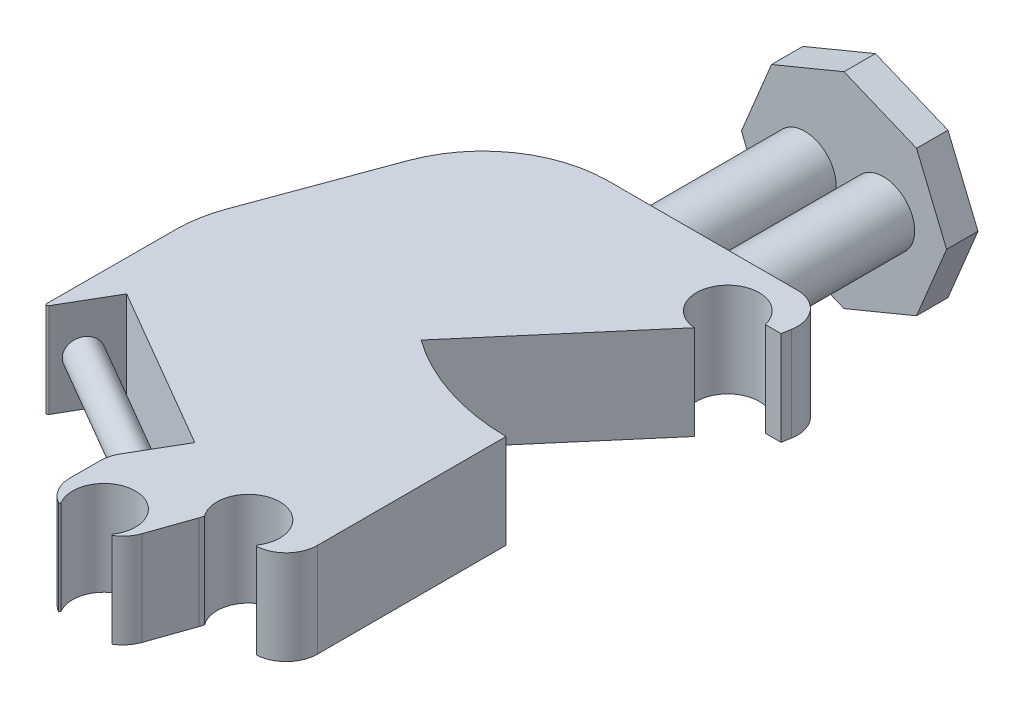
from build123d import *

# Parameters (mm, degrees)
SKETCH1_W                      = 5
SKETCH1_H                      = 25
BOSS_EXTRUDE1_DEPTH            = 10
BOSS_EXTRUDE2_DEPTH            = 2.5
BOSS_EXTRUDE3_START            = 2.5
BOSS_EXTRUDE3_DEPTH            = 2.5
BOSS_EXTRUDE4_DEPTH            = 5
DRAFT1_ANGLE                   = 60
DRAFT2_ANGLE                   = -10
SKETCH6_W                      = 5
SKETCH6_H                      = 15
SKETCH7_W                      = 5
SKETCH7_H                      = 15
SKETCH8_W                      = 5
SKETCH8_H                      = 25
F_10_0_10_DIAMETER_HOLE1_D     = 10
F_10_0_10_DIAMETER_HOLE1_DEPTH = 23.832037061
FILLET1_R                      = 5
FILLET2_R                      = 20


with BuildPart() as part:
    # Sketch1 → Revolve1 (revolve)
    with BuildSketch(Plane(origin=(0, -7.5, 0), x_dir=(1, 0, 0), z_dir=(0, 1, 0))):
        with Locations((-5.811233855, 90.876419512)):
            Rectangle(SKETCH1_W, SKETCH1_H)
    revolve(axis=Axis((-8.311233855, -7.5, -103.376419512), (0, 0, 1)))

    # Sketch2 → Boss-Extrude1 (add)
    with BuildSketch(Plane(origin=(0, -2.5, 0), x_dir=(1, 0, 0), z_dir=(0, 1, 0))):
        with BuildLine():
            Line((-20.904218066, -4.060593221), (-17.745761276, -10))
            ThreePointArc((-17.745761276, -10), (-16.42436709, -8.86625844), (-15.571850751, -7.348145002))
            Line((-15.571850751, -7.348145002), (-13.235172111, -0.671920317))
            ThreePointArc((-13.235172111, -0.671920317), (-13.124251068, -0.312083076), (-13.040724348, 0.055081199))
            ThreePointArc((-13.040724348, 0.055081199), (-9.034250588, -1.999882688), (-5, 0))
            ThreePointArc((-5, 0), (-1.464466094, 1.464466094), (0, 5))
            Line((0, 5), (0, 35))
            ThreePointArc((0, 35), (-10.533604853, 36.723434751), (-20.057952451, 41.541511272))
            Line((-20.057952451, 41.541511272), (5.197843412, 71.090018979))
            Line((5.197843412, 71.090018979), (8.982632418, 71.090018979))
            Line((8.982632418, 71.090018979), (8.982632418, 78.376419512))
            Line((8.982632418, 78.376419512), (-8.311233855, 78.376419512))
            Line((-8.311233855, 78.376419512), (-41.017367582, 78.376419512))
            Line((-41.017367582, 78.376419512), (-54.819345863, 40.83303933))
            Line((-54.819345863, 40.83303933), (-54.896976862, 16.766177236))
            ThreePointArc((-54.896976862, 16.766177236), (-54.712461515, 16.524099343), (-54.430876141, 16.639673113))
            Line((-54.430876141, 16.639673113), (-49.872077715, 24.477250263))
            Line((-49.872077715, 24.477250263), (-8.967847829, 0.684930874))
            Line((-8.967847829, 0.684930874), (-28.967743782, 0.74944331))
            Line((-28.967743782, 0.74944331), (-28.987601327, -5.406715976))
            ThreePointArc((-28.987601327, -5.406715976), (-28.311946244, -7.932877153), (-26.453503439, -9.772494077))
            Line((-26.453503439, -9.772494077), (-20.904218066, -4.060593221))
        make_face()
    extrude(amount=-BOSS_EXTRUDE1_DEPTH)

    # Sketch3 → Boss-Extrude2 (add)
    with BuildSketch(Plane.XZ.offset(12.5)):
        with BuildLine():
            Line((-20.904218066, 4.060593221), (-17.745761276, 10))
            ThreePointArc((-17.745761276, 10), (-16.42436709, 8.86625844), (-15.571850751, 7.348145002))
            Line((-15.571850751, 7.348145002), (-13.235172111, 0.671920317))
            ThreePointArc((-13.235172111, 0.671920317), (-13.124251068, 0.312083076), (-13.040724348, -0.055081199))
            ThreePointArc((-13.040724348, -0.055081199), (-9.034250588, 1.999882688), (-5, 0))
            ThreePointArc((-5, 0), (-1.464466094, -1.464466094), (0, -5))
            Line((0, -5), (0, -35))
            ThreePointArc((0, -35), (-10.533604853, -36.723434751), (-20.057952451, -41.541511272))
            Line((-20.057952451, -41.541511272), (5.197843412, -71.090018979))
            Line((5.197843412, -71.090018979), (8.982632418, -71.090018979))
            Line((8.982632418, -71.090018979), (8.982632418, -78.376419512))
            Line((8.982632418, -78.376419512), (-41.017367582, -78.376419512))
            Line((-41.017367582, -78.376419512), (-54.819345863, -40.83303933))
            Line((-54.819345863, -40.83303933), (-54.896976862, -16.766177236))
            ThreePointArc((-54.896976862, -16.766177236), (-54.712461515, -16.524099343), (-54.430876141, -16.639673113))
            Line((-54.430876141, -16.639673113), (-49.872077715, -24.477250263))
            Line((-49.872077715, -24.477250263), (-8.967847829, -0.684930874))
            Line((-8.967847829, -0.684930874), (-28.967743782, -0.74944331))
            Line((-28.967743782, -0.74944331), (-28.987601327, 5.406715976))
            ThreePointArc((-28.987601327, 5.406715976), (-28.311946244, 7.932877153), (-26.453503439, 9.772494077))
            Line((-26.453503439, 9.772494077), (-20.904218066, 4.060593221))
        make_face()
    extrude(amount=BOSS_EXTRUDE2_DEPTH)

    # Sketch4 → Boss-Extrude3 (add)
    with BuildSketch(Plane(origin=(0, -2.5, 0), x_dir=(-1, 0, 0), z_dir=(0, 1, 0)).offset(BOSS_EXTRUDE3_START)):
        with BuildLine():
            Line((20.904218066, 4.060593221), (26.453503439, 9.772494077))
            ThreePointArc((26.453503439, 9.772494077), (28.311946244, 7.932877153), (28.987601327, 5.406715976))
            Line((28.987601327, 5.406715976), (28.967743782, -0.74944331))
            Line((28.967743782, -0.74944331), (8.967847829, -0.684930874))
            Line((8.967847829, -0.684930874), (49.872077715, -24.477250263))
            Line((49.872077715, -24.477250263), (54.430876141, -16.639673113))
            ThreePointArc((54.430876141, -16.639673113), (54.712461515, -16.524099343), (54.896976862, -16.766177236))
            Line((54.896976862, -16.766177236), (54.819345863, -40.83303933))
            Line((54.819345863, -40.83303933), (41.017367582, -78.376419512))
            Line((41.017367582, -78.376419512), (-8.982632418, -78.376419512))
            Line((-8.982632418, -78.376419512), (-8.982632418, -71.090018979))
            Line((-8.982632418, -71.090018979), (-5.197843412, -71.090018979))
            Line((-5.197843412, -71.090018979), (20.057952451, -41.541511272))
            ThreePointArc((20.057952451, -41.541511272), (10.533604853, -36.723434751), (0, -35))
            Line((0, -35), (0, -5))
            ThreePointArc((0, -5), (1.464466094, -1.464466094), (5, 0))
            ThreePointArc((5, 0), (9.034250588, 1.999882688), (13.040724348, -0.055081199))
            ThreePointArc((13.040724348, -0.055081199), (13.124251068, 0.312083076), (13.235172111, 0.671920317))
            Line((13.235172111, 0.671920317), (15.571850751, 7.348145002))
            ThreePointArc((15.571850751, 7.348145002), (16.42436709, 8.86625844), (17.745761276, 10))
            Line((17.745761276, 10), (20.904218066, 4.060593221))
        make_face()
    extrude(amount=-BOSS_EXTRUDE3_DEPTH)

    # Sketch5 → Boss-Extrude4 (add)
    with BuildSketch(Plane.XY.offset(-103.376419512)):
        Polygon((-3.012739699, 4.048494156), (-14.561233855, 8.832037061), (-26.109728012, 4.048494156), (-30.893270916, -7.5), (-26.109728012, -19.048494156), (-14.561233855, -23.832037061), (-3.012739699, -19.048494156), (1.770803206, -7.5), align=None)
    extrude(amount=-BOSS_EXTRUDE4_DEPTH)

    # Draft1
    draft1_faces = [part.faces().sort_by_distance(p)[0] for p in [
        (-18.967795805, -7.5, -0.717187092),
    ]]
    draft(draft1_faces, Plane(origin=(-28.967743782, -12.5, -0.74944331), x_dir=(0.0032256218002524395, 0, -0.9999947976684688), z_dir=(-0.9999947976684688, 0, -0.0032256218002524395)), DRAFT1_ANGLE)

    # Draft2
    draft2_faces = [part.faces().sort_by_distance(p)[0] for p in [
        (8.982632418, -7.5, -74.733219246),
    ]]
    draft(draft2_faces, Plane(origin=(-8.311233855, -12.5, -78.376419512), x_dir=(-1, 0, 0), z_dir=(0, 0, -1)), DRAFT2_ANGLE)

    # Sketch6 → Cut-Revolve1 (revolve, cut)
    with BuildSketch(Plane.XY.offset(7)):
        with Locations((-19.5, -7.5)):
            Rectangle(SKETCH6_W, SKETCH6_H)
    revolve(axis=Axis((-22, 0, 7), (0, -1, 0)), mode=Mode.SUBTRACT)

    # Sketch7 → Cut-Revolve2 (revolve, cut)
    with BuildSketch(Plane(origin=(0, 0, -3), x_dir=(-1, 0, 0), z_dir=(0, 0, -1))):
        with Locations((6.5, -7.5)):
            Rectangle(SKETCH7_W, SKETCH7_H)
    revolve(axis=Axis((-9, -15, -3), (0, 1, 0)), mode=Mode.SUBTRACT)

    # Sketch8 → Revolve2 (revolve)
    with BuildSketch(Plane(origin=(0, -7.5, 0), x_dir=(1, 0, 0), z_dir=(0, 1, 0))):
        with Locations((-18.311233855, 90.876419512)):
            Rectangle(SKETCH8_W, SKETCH8_H)
    revolve(axis=Axis((-20.811233855, -7.5, -103.376419512), (0, 0, 1)))

    # Sketch9 → Revolve3 (revolve)
    with BuildSketch(Plane(origin=(0, -7.5, 0), x_dir=(1, 0, 0), z_dir=(0, 1, 0))):
        Polygon((-51.129054889, 22.316230044), (-52.386032062, 20.155209826), (-26.453789436, 5.071483748), (-25.196812263, 7.232503967), align=None)
    revolve(axis=Axis((-53.325247092, -7.5, -20.701512837), (0.8644080875330462, 0, 0.502790869256256)))

    # Ø10.0 (10) Diameter Hole1
    with Locations(Plane(origin=(0, -15, 0), x_dir=(-1, 0, 0), z_dir=(0, -1, 0))):
        with Locations((-0.318427602, 69.998551454)):
            Hole(F_10_0_10_DIAMETER_HOLE1_D / 2, depth=F_10_0_10_DIAMETER_HOLE1_DEPTH)

    # Chamfer1
    # the kernel refuses this chamfer: 0.262951912, 0.262770817 mm, written as the material it takes off along each edge
    with BuildSketch(Plane(origin=(-5, -15.679311202, 0), x_dir=(0.9996632496701223, 4.862291359988254e-15, -0.02594970633688609), z_dir=(0, 1, 0))) as chamfer1_piece_1:
        with BuildLine():
            Line((0.259497063, 0), (0.159812325, 0.213399124))
            ThreePointArc((0.159812325, 0.213399124), (0.082816569, 0.107621918), (0, 0))
            ThreePointArc((0, 0), (0.131972937, -0.001683257), (0.259497063, 0))
        make_face()
    extrude(amount=16.358622404, mode=Mode.SUBTRACT)

    # Fillet1
    fillet1_edges = [part.edges().sort_by_distance(p)[0] for p in [
        (-28.967743782, -7.5, -0.74944331),
        (8.982632418, -7.5, -78.376419512),
    ]]
    fillet(fillet1_edges, radius=FILLET1_R)

    # Fillet2
    fillet2_edges = [part.edges().sort_by_distance(p)[0] for p in [
        (-41.017367582, -7.5, -78.376419512),
        (-54.819345863, -7.5, -40.83303933),
    ]]
    fillet(fillet2_edges, radius=FILLET2_R)


solid = part.part
